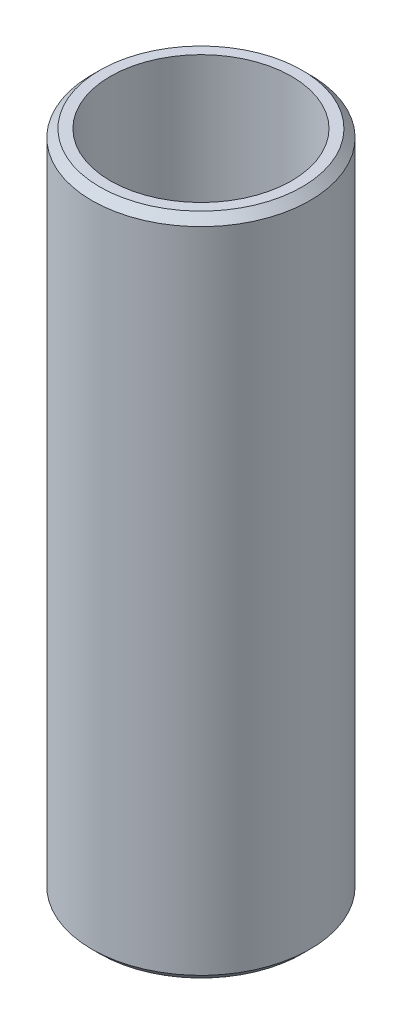
from build123d import *

# Parameters (mm, degrees)
SKETCH1_R           = 32.5
BOSS_EXTRUDE1_DEPTH = 197.998398807
SKETCH2_R           = 26.999346541
CUT_EXTRUDE1_DEPTH  = 204.26304615
CHAMFER1_SIZE       = 2.349133149


with BuildPart() as part:
    # Sketch1 → Boss-Extrude1 (new body)
    with BuildSketch(Plane(origin=(0, 0, 0), x_dir=(1, 0, 0), z_dir=(0, 1, 0))):
        Circle(SKETCH1_R)
    extrude(amount=BOSS_EXTRUDE1_DEPTH)

    # Sketch2 → Cut-Extrude1 (cut, through all)
    with BuildSketch(Plane(origin=(0, 0, 0), x_dir=(1, 0, 0), z_dir=(0, 1, 0))):
        Circle(SKETCH2_R)
    extrude(amount=CUT_EXTRUDE1_DEPTH, mode=Mode.SUBTRACT)

    # Chamfer1
    chamfer1_edges = [part.edges().sort_by_distance(p)[0] for p in [
        (-32.5, 197.998398807, 0),
        (-32.5, 0, 0),
    ]]
    chamfer(chamfer1_edges, length=CHAMFER1_SIZE)


solid = part.part
